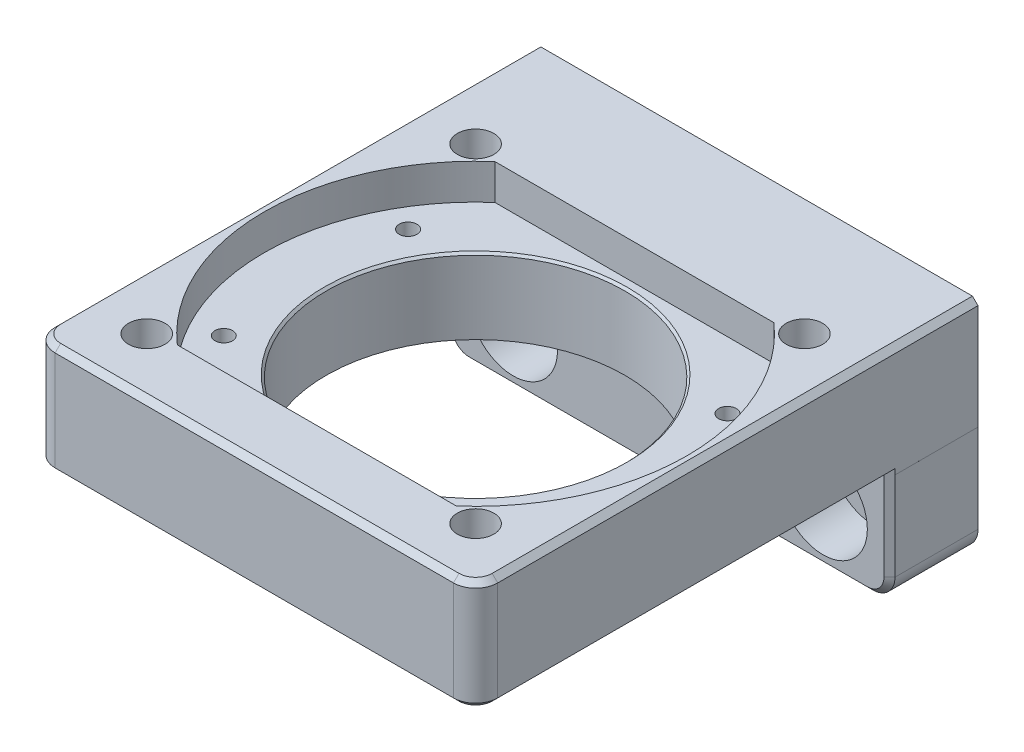
from build123d import *

# Parameters (mm, degrees)
EXTRUDE_START                = 22.551487981
EXTRUDE_1_DEPTH              = 10
SKETCH_3_R                   = 13.5
CUT_EXTRUDE_1_DEPTH          = 34.402382852
CUT_EXTRUDE_2_DEPTH          = 3.2
HOLE_WIZARD_M2_1_D           = 1.6
HOLE_WIZARD_M2_1_ON_FACE_2_D = 1.6
HOLE_WIZARD_M4_1_D           = 3.3
PATTERN_CIRCULAR_1_COUNT     = 4
FILLET_1_R                   = 2
CUT_EXTRUDE_3_DEPTH          = 3.2
SKETCH_14_W                  = 40.000000073
SKETCH_14_H                  = 10
EXTRUDE_3_DEPTH              = 8
HOLE_WIZARD_2_D              = 4.5
HOLE_WIZARD_2_CBORE_D        = 8
HOLE_WIZARD_2_CBORE_DEPTH    = 4.6
FILLET_3_R                   = 2
CHAMFER_3_SIZE               = 0.5
CHAMFER_4_SIZE               = 0.5
MM_1_D                       = 4
MM_1_DEPTH                   = 5
MM_1_TIP                     = 1.201721238
MM_1_ON_FACE_2_D             = 4
MM_1_ON_FACE_2_DEPTH         = 5
MM_1_ON_FACE_2_TIP           = 1.201721238
CHAMFER_5_SIZE               = 0.2


# Read off the part's stored shape, not the designer's step: 凸台-拉伸1
with BuildPart() as part:
    # 凸台-拉伸1 outline → 凸台-拉伸1 (new body)
    with BuildSketch(Plane(origin=(0, 0, 0), x_dir=(1, 0, 0), z_dir=(0, 1, 0)).offset(EXTRUDE_START)):
        Polygon((-19.708163337, 0), (20.291836663, 0), (20.291836663, 45.401537164), (-19.708163337, 45.399116322), align=None)
    extrude(amount=EXTRUDE_1_DEPTH)

    # 草图3 → 切除-拉伸1 (cut, through all)
    with BuildSketch(Plane(origin=(0, 32.551487981, -20.825928422), x_dir=(-1, 0, 0), z_dir=(0, -1, 0))):
        with Locations(Location((-0.291836663, -0.825928422, 0), (0, 0, 90))):
            Circle(SKETCH_3_R)
    extrude(amount=CUT_EXTRUDE_1_DEPTH, mode=Mode.SUBTRACT)

    # 草图6 → 切除-拉伸2 (cut)
    with BuildSketch(Plane(origin=(0, 32.551487981, -20.825928422), x_dir=(-1, 0, 0), z_dir=(0, -1, 0))):
        with BuildLine():
            Line((12.2943661, 13.474071578), (-12.878039427, 13.474071578))
            ThreePointArc((-12.878039427, 13.474071578), (-19.341836663, -0.825928422), (-12.878039427, -15.125928422))
            Line((-12.878039427, -15.125928422), (12.2943661, -15.125928422))
            ThreePointArc((12.2943661, -15.125928422), (18.758163337, -0.825928422), (12.2943661, 13.474071578))
        make_face()
    extrude(amount=CUT_EXTRUDE_2_DEPTH, mode=Mode.SUBTRACT)

    # M2 螺纹孔1 (through all)
    with Locations(Plane(origin=(14.721836663, 29.351487981, -11.67), x_dir=(0, 0, 1), z_dir=(0, 1, 0))):
        with Locations((0, 0), (-16.66, 0), (-16.66, -28.86), (0, -28.86)):
            Hole(HOLE_WIZARD_M2_1_D / 2)

    # M2 螺纹孔1 on face 2 (through all)
    with Locations(Plane(origin=(36.124820123, 11.946154634, 0), x_dir=(0, 0, 1), z_dir=(0, 1, 0))):
        with Locations((0, 0)):
            Hole(HOLE_WIZARD_M2_1_ON_FACE_2_D / 2)

    # M4 螺纹孔1 (through all)
    with Locations(Plane(origin=(-14.567496717, 32.551487981, -5.142225972), x_dir=(0, 0, 1), z_dir=(0, 1, 0))):
        with Locations((0, 0)):
            hole_wizard_m4_1 = Hole(HOLE_WIZARD_M4_1_D / 2)

    # 阵列(圆周)1: M4 螺纹孔1 ×4 about axis
    pattern_circular_1_axis = Axis((0.291836663, 0, -20), (0, 1, 0))
    for i in range(1, PATTERN_CIRCULAR_1_COUNT):
        add(hole_wizard_m4_1.rotate(pattern_circular_1_axis, i * 360 / PATTERN_CIRCULAR_1_COUNT), mode=Mode.SUBTRACT)

    # 圆角1
    fillet_1_edges = [part.edges().sort_by_distance(p)[0] for p in [
        (-19.708163337, 27.551487981, 0),
        (20.291836663, 27.551487981, 0),
    ]]
    fillet(fillet_1_edges, radius=FILLET_1_R)

    # 草图10 → 切除-拉伸3 (cut)
    with BuildSketch(Plane(origin=(0, 32.551487981, 0), x_dir=(1, 0, 0), z_dir=(0, 1, 0))):
        with BuildLine():
            Line((12.896895172, 5.65), (-12.313221845, 5.65))
            ThreePointArc((-12.313221845, 5.65), (-18.808163337, 20), (-12.313221845, 34.35))
            Line((-12.313221845, 34.35), (12.896895172, 34.35))
            ThreePointArc((12.896895172, 34.35), (19.391836663, 20), (12.896895172, 5.65))
        make_face()
        with BuildLine():
            Line((12.878039427, 5.7), (-12.2943661, 5.7))
            ThreePointArc((-12.2943661, 5.7), (-18.758163337, 20), (-12.2943661, 34.3))
            Line((-12.2943661, 34.3), (12.878039427, 34.3))
            ThreePointArc((12.878039427, 34.3), (19.341836663, 20), (12.878039427, 5.7))
        make_face(mode=Mode.SUBTRACT)
    extrude(amount=-CUT_EXTRUDE_3_DEPTH, mode=Mode.SUBTRACT)

    # 草图14 → 凸台-拉伸3 (add)
    with BuildSketch(Plane(origin=(-0.002747675, 0, -45.400308914), x_dir=(-0.999999998168601, 0, 6.0521054570844804e-05), z_dir=(-6.0521054570844804e-05, 0, -0.999999998168601))):
        with Locations((-0.294584339, 17.551487981)):
            Rectangle(SKETCH_14_W, SKETCH_14_H)
    extrude(amount=-EXTRUDE_3_DEPTH)

    # 打孔尺寸(%根据)内六角圆柱头螺钉的类型2 (through all)
    with Locations(Plane(origin=(-13.707679179, 17.551487981, -37.399479463), x_dir=(0.999999998169, 0, -6.0521055e-05), z_dir=(6.0521055e-05, 0, 0.999999998169))):
        with Locations((0, 0)):
            hole_wizard_2 = CounterBoreHole(HOLE_WIZARD_2_D / 2, HOLE_WIZARD_2_CBORE_D / 2, HOLE_WIZARD_2_CBORE_DEPTH)

    # 镜向1: 打孔尺寸(%根据)内六角圆柱头螺钉的类型2 across plane
    add(hole_wizard_2.mirror(Plane(origin=(0.29488819, 7.139e-06, -1.7847e-05), x_dir=(6.052105453537725e-05, 1.4651192230755134e-09, 0.999999998168601), z_dir=(0.9999999978755771, 2.420842186592359e-05, -6.052105455311136e-05))), mode=Mode.SUBTRACT)

    # 圆角3
    fillet_3_edges = [part.edges().sort_by_distance(p)[0] for p in [
        (20.292078748, 12.551487981, -41.401537171),
        (-19.707921252, 12.551487981, -41.399116329),
    ]]
    fillet(fillet_3_edges, radius=FILLET_3_R)

    # 倒角3
    # the kernel refuses this chamfer: 0.5 mm, written as the material it takes off along each edge
    with BuildSketch(Plane(origin=(20.292320832, 14.551487981, -37.401537179), x_dir=(-0.9996202510011412, 0, 0.027556374732822585), z_dir=(0, 1, 0))) as chamfer_3_piece_1:
        Polygon((CHAMFER_3_SIZE * 0.999621916911, -CHAMFER_3_SIZE * 0.0274958766106), (-CHAMFER_3_SIZE * 0.0274958766106, -CHAMFER_3_SIZE * 0.999621916911), (0, 0), align=None)
    extrude(amount=8, mode=Mode.SUBTRACT)
    with BuildSketch(Plane(origin=(-17.707679172, 12.551487981, -37.399237379), x_dir=(1.6640794488223208e-06, 0.9996219169112968, 0.027495876560227457), z_dir=(0.999999998168601, 0, -6.0521054570844804e-05))) as chamfer_3_piece_2:
        Polygon((CHAMFER_3_SIZE * 0.999621916911, -CHAMFER_3_SIZE * 0.0274958766106), (-CHAMFER_3_SIZE * 0.0274958766106, -CHAMFER_3_SIZE * 0.999621916911), (0, 0), align=None)
    extrude(amount=36.000000073, mode=Mode.SUBTRACT)
    with BuildSketch(Plane(origin=(-19.707679168, 22.551487981, -37.399116337), x_dir=(-0.027556374732808586, 0, -0.9996202510011414), z_dir=(0, -1, 0))) as chamfer_3_piece_3:
        Polygon((CHAMFER_3_SIZE * 0.999621916911, CHAMFER_3_SIZE * 0.0274958766106), (-CHAMFER_3_SIZE * 0.0274958766106, CHAMFER_3_SIZE * 0.999621916911), (0, 0), align=None)
    extrude(amount=8, mode=Mode.SUBTRACT)
    with BuildSketch(Plane(origin=(-17.707679172, 14.551487981, -37.399237379), x_dir=(-0.999999998168601, 0, 6.0521054571438526e-05), z_dir=(0, 1, 0))) as chamfer_3_piece_4:
        Polygon((2, -CHAMFER_3_SIZE), (2 - CHAMFER_3_SIZE, 0), (2, 0), align=None)
    revolve(axis=Axis((-17.707679172, 14.551487981, -37.399237379), (6.0521054570844804e-05, 0, 0.999999998168601)), revolution_arc=90, mode=Mode.SUBTRACT)
    with BuildSketch(Plane(origin=(18.292320836, 14.551487981, -37.401416137), x_dir=(0, -1, 0), z_dir=(-0.999999998168601, 0, 6.0521054570844804e-05))) as chamfer_3_piece_5:
        Polygon((2 - CHAMFER_3_SIZE, 0), (2, -CHAMFER_3_SIZE), (2, 0), align=None)
    revolve(axis=Axis((18.292320836, 14.551487981, -37.401416137), (6.0521054570844804e-05, 0, 0.999999998168601)), revolution_arc=90, mode=Mode.SUBTRACT)

    # 倒角4
    # the kernel refuses this chamfer: 0.5 mm, written as the material it takes off along each edge
    with BuildSketch(Plane(origin=(20.291836663, 22.551487981, -39.186924708), x_dir=(-0.9996219169112968, -0.027495876610589005, 3.063515239507053e-14), z_dir=(0, 1.1141726022756645e-12, 1.0))) as chamfer_4_piece_1_section:
        Polygon((CHAMFER_4_SIZE * 0.999621916911, -CHAMFER_4_SIZE * 0.0274958766106), (-CHAMFER_4_SIZE * 0.0274958766106, -CHAMFER_4_SIZE * 0.999621916911), (0, 0), align=None)
    chamfer_4_piece_1 = extrude(amount=37.186924708, mode=Mode.PRIVATE)
    chamfer_4_piece_1 = split(chamfer_4_piece_1, bisect_by=Plane(origin=(20.073247495, 22.739018286, -37.682467586), z_dir=(0.7071495747397631, 0, 0.7070639850433426)), keep=Keep.TOP, mode=Mode.PRIVATE)
    with BuildSketch(Plane(origin=(20.291836663, 22.551487981, -39.186924708), x_dir=(-0.9996219169112968, -0.027495876610589005, 3.063515239507053e-14), z_dir=(0, 1.1141726022756645e-12, 1.0))) as chamfer_4_piece_2_section:
        Polygon((CHAMFER_4_SIZE * 0.999621916911, -CHAMFER_4_SIZE * 0.0274958766106), (-CHAMFER_4_SIZE * 0.0274958766106, -CHAMFER_4_SIZE * 0.999621916911), (0, 0), align=None)
    chamfer_4_piece_2 = extrude(amount=37.186924708, mode=Mode.PRIVATE)
    chamfer_4_piece_2 = split(chamfer_4_piece_2, bisect_by=Plane(origin=(19.792078741, 22.551609023, -37.401506904), z_dir=(6.0521054570844804e-05, 0, 0.999999998168601)), keep=Keep.TOP, mode=Mode.PRIVATE)
    with BuildSketch(Plane(origin=(18.291836663, 22.551487981, -2), x_dir=(0, 0, 1), z_dir=(-1, 0, 0))) as chamfer_4_piece_3:
        Polygon((2 - CHAMFER_4_SIZE, 0), (2, CHAMFER_4_SIZE), (2, 0), align=None)
    chamfer_4_piece_3_solid = revolve(axis=Axis((18.291836663, 22.551487981, -2), (0, 1, 0)), revolution_arc=90, mode=Mode.PRIVATE)
    with BuildSketch(Plane(origin=(-17.708163337, 22.551487981, 0), x_dir=(0, -0.02749587661058908, -0.9996219169112968), z_dir=(1, 0, 0)), Plane(origin=(-17.708163337, 32.551487981, 0), x_dir=(0, -0.9996219169112968, 0.027495876610586483), z_dir=(1, 0, 0))) as chamfer_4_piece_4:
        Polygon((CHAMFER_4_SIZE * 0.999621916911, CHAMFER_4_SIZE * 0.0274958766106), (-CHAMFER_4_SIZE * 0.0274958766106, CHAMFER_4_SIZE * 0.999621916911), (0, 0), align=None)
    chamfer_4_piece_4_solid = extrude(amount=36, mode=Mode.PRIVATE)
    with BuildSketch(Plane(origin=(-17.708163337, 22.551487981, -2), x_dir=(0, 0, 1), z_dir=(1, 0, 0))) as chamfer_4_piece_5:
        Polygon((2 - CHAMFER_4_SIZE, 0), (2, -CHAMFER_4_SIZE), (2, 0), align=None)
    chamfer_4_piece_5_solid = revolve(axis=Axis((-17.708163337, 22.551487981, -2), (0, -1, 0)), revolution_arc=90, mode=Mode.PRIVATE)
    with BuildSketch(Plane(origin=(-19.708163337, 22.551487981, -46.684957816), x_dir=(0.9996219169112968, -0.027495876610589005, 0), z_dir=(0, 0, 1))) as chamfer_4_piece_6_section:
        Polygon((CHAMFER_4_SIZE * 0.999621916911, CHAMFER_4_SIZE * 0.0274958766106), (-CHAMFER_4_SIZE * 0.0274958766106, CHAMFER_4_SIZE * 0.999621916911), (0, 0), align=None)
    chamfer_4_piece_6 = extrude(amount=44.684957816, mode=Mode.PRIVATE)
    chamfer_4_piece_6 = split(chamfer_4_piece_6, bisect_by=Plane(origin=(-19.707860752, 22.801412311, -40.399458205), z_dir=(-0.999999998168601, 0, 6.0521054570844804e-05)), keep=Keep.TOP, mode=Mode.PRIVATE)
    with BuildSketch(Plane(origin=(-19.708163337, 22.551487981, -46.684957816), x_dir=(0.9996219169112968, -0.027495876610589005, 0), z_dir=(0, 0, 1))) as chamfer_4_piece_7_section:
        Polygon((CHAMFER_4_SIZE * 0.999621916911, CHAMFER_4_SIZE * 0.0274958766106), (-CHAMFER_4_SIZE * 0.0274958766106, CHAMFER_4_SIZE * 0.999621916911), (0, 0), align=None)
    chamfer_4_piece_7 = extrude(amount=44.684957816, mode=Mode.PRIVATE)
    chamfer_4_piece_7 = split(chamfer_4_piece_7, bisect_by=Plane(origin=(-10.80541075, 22.718313122, -28.997895145), z_dir=(-0.7070639850433426, 0, 0.7071495747397631)), keep=Keep.TOP, mode=Mode.PRIVATE)
    with BuildSketch(Plane(origin=(20.291836663, 32.551487981, -2), x_dir=(0.027495876610589196, -0.9996219169112968, 0), z_dir=(0, 0, -1))) as chamfer_4_piece_8:
        Polygon((CHAMFER_4_SIZE * 0.999621916911, CHAMFER_4_SIZE * 0.0274958766106), (-CHAMFER_4_SIZE * 0.0274958766106, CHAMFER_4_SIZE * 0.999621916911), (0, 0), align=None)
    chamfer_4_piece_8_solid = extrude(amount=44.687378658, mode=Mode.PRIVATE)
    with BuildSketch(Plane(origin=(18.291836663, 32.551487981, -2), x_dir=(0, 0, 1), z_dir=(-1, 0, 0))) as chamfer_4_piece_9:
        Polygon((2, -CHAMFER_4_SIZE), (2 - CHAMFER_4_SIZE, 0), (2, 0), align=None)
    chamfer_4_piece_9_solid = revolve(axis=Axis((18.291836663, 32.551487981, -2), (0, 1, 0)), revolution_arc=90, mode=Mode.PRIVATE)
    with BuildSketch(Plane(origin=(-17.708163337, 32.551487981, -2), x_dir=(0, 0, 1), z_dir=(1, 0, 0))) as chamfer_4_piece_10:
        Polygon((2, CHAMFER_4_SIZE), (2 - CHAMFER_4_SIZE, 0), (2, 0), align=None)
    chamfer_4_piece_10_solid = revolve(axis=Axis((-17.708163337, 32.551487981, -2), (0, -1, 0)), revolution_arc=90, mode=Mode.PRIVATE)
    with BuildSketch(Plane(origin=(-19.708163337, 32.551487981, -46.684957816), x_dir=(-0.027495876610589196, -0.9996219169112968, 0), z_dir=(0, 0, 1))) as chamfer_4_piece_11:
        Polygon((CHAMFER_4_SIZE * 0.999621916911, CHAMFER_4_SIZE * 0.0274958766106), (-CHAMFER_4_SIZE * 0.0274958766106, CHAMFER_4_SIZE * 0.999621916911), (0, 0), align=None)
    chamfer_4_piece_11_solid = extrude(amount=44.684957816, mode=Mode.PRIVATE)
    add([chamfer_4_piece_1, chamfer_4_piece_2, chamfer_4_piece_3_solid, chamfer_4_piece_4_solid, chamfer_4_piece_5_solid, chamfer_4_piece_6, chamfer_4_piece_7, chamfer_4_piece_8_solid, chamfer_4_piece_9_solid, chamfer_4_piece_10_solid, chamfer_4_piece_11_solid], mode=Mode.SUBTRACT)

    # 大小mm 暗销孔1
    with Locations(Plane(origin=(6.291594588, 17.552165811, -45.400689855), x_dir=(-0.999999998169, 0, 6.0521055e-05), z_dir=(-6.0521055e-05, 0, -0.999999998169))):
        with Locations((0, 0)):
            Hole(MM_1_D / 2, depth=MM_1_DEPTH)
            with Locations((0, 0, -(MM_1_DEPTH + MM_1_TIP / 2))):  # 118° drill point
                Cone(0, MM_1_D / 2, MM_1_TIP, mode=Mode.SUBTRACT)

    # 大小mm 暗销孔1 on face 2
    with Locations(Plane(origin=(-5.708163362, 17.551487981, -45.399963617), x_dir=(-0.99999999814, 0, 6.1e-05), z_dir=(-6.1e-05, 0, -0.99999999814))):
        with Locations((0, 0)):
            Hole(MM_1_ON_FACE_2_D / 2, depth=MM_1_ON_FACE_2_DEPTH)
            with Locations((0, 0, -(MM_1_ON_FACE_2_DEPTH + MM_1_ON_FACE_2_TIP / 2))):  # 118° drill point
                Cone(0, MM_1_ON_FACE_2_D / 2, MM_1_ON_FACE_2_TIP, mode=Mode.SUBTRACT)

    # 倒角5
    chamfer_5_edges = [part.edges().sort_by_distance(p)[0] for p in [
        (0.291836663, 29.351487981, -6.5),
    ]]
    chamfer(chamfer_5_edges, length=CHAMFER_5_SIZE)


solid = part.part
